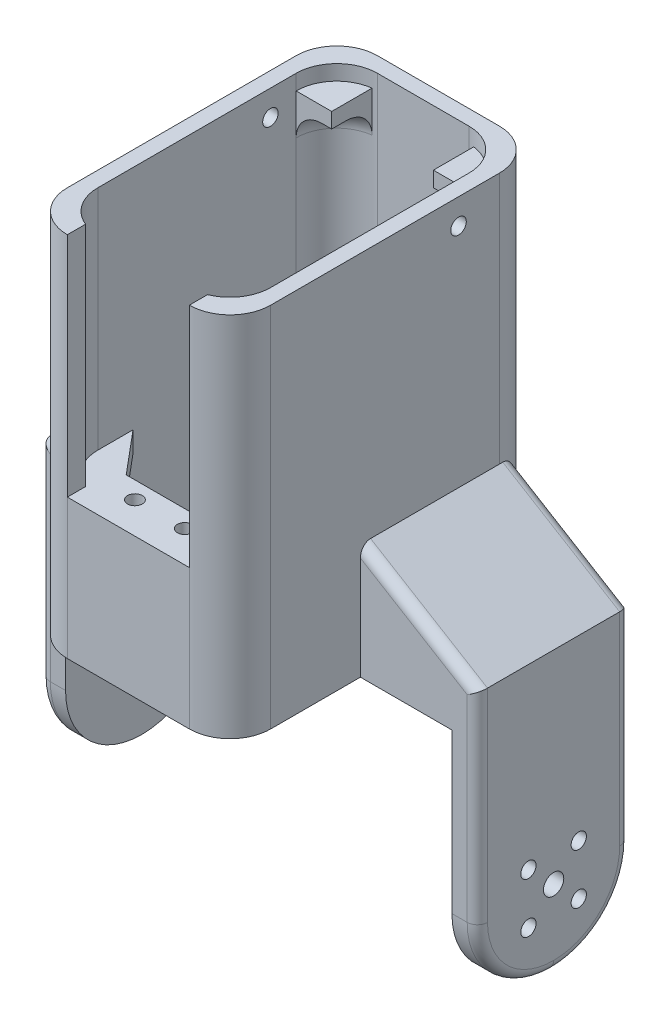
from build123d import *

# Parameters (mm, degrees)
SKETCH1_W           = 40
SKETCH1_H           = 61
SKETCH1_W_2         = 34
SKETCH1_H_2         = 55
BOSS_EXTRUDE1_DEPTH = 72.2
FILLET1_R           = 8
FILLET2_R           = 8
SKETCH2_R           = 1.45
BOSS_EXTRUDE2_DEPTH = 4
SKETCH3_W           = 24
SKETCH3_H           = 44.7
CUT_EXTRUDE1_DEPTH  = 4
BOSS_EXTRUDE3_DEPTH = 30
FILLET3_R           = 15
FILLET4_R           = 15
SKETCH6_R           = 2
CUT_EXTRUDE2_DEPTH  = 5
SKETCH8_R           = 1.505
CUT_EXTRUDE3_DEPTH  = 5
FILLET5_R           = 2
BOSS_EXTRUDE5_DEPTH = 3
FILLET7_R           = 5
SKETCH12_R          = 1.525
CUT_EXTRUDE4_DEPTH  = 3
CUT_EXTRUDE5_START  = -3
SKETCH13_R          = 1.525
CUT_EXTRUDE5_DEPTH  = 3
BOSS_EXTRUDE6_DEPTH = 4


with BuildPart() as part:
    # Sketch1 → Boss-Extrude1 (new body)
    with BuildSketch(Plane(origin=(0, 0, 0), x_dir=(1, 0, 0), z_dir=(0, 1, 0))):
        with Locations((20, 30.5)):
            Rectangle(SKETCH1_W, SKETCH1_H)
        with Locations((20, 30.5)):
            Rectangle(SKETCH1_W_2, SKETCH1_H_2, mode=Mode.SUBTRACT)
    extrude(amount=BOSS_EXTRUDE1_DEPTH)

    # Fillet1
    fillet1_edges = [part.edges().sort_by_distance(p)[0] for p in [
        (37, 36.1, -3),
        (37, 36.1, -58),
        (3, 36.1, -58),
        (3, 36.1, -3),
    ]]
    fillet(fillet1_edges, radius=FILLET1_R)

    # Fillet2
    fillet2_edges = [part.edges().sort_by_distance(p)[0] for p in [
        (0, 36.1, -61),
        (40, 36.1, -61),
        (40, 36.1, 0),
        (0, 36.1, 0),
    ]]
    fillet(fillet2_edges, radius=FILLET2_R)

    # Sketch2 → Boss-Extrude2 (add)
    # profile 1 of 2: a face of its own
    with BuildSketch(Plane(origin=(0, 27.5, 0), x_dir=(-1, 0, 0), z_dir=(0, -1, 0))):
        with BuildLine():
            ThreePointArc((-3.127033596, 51.42), (-5.869697865, 56.138403701), (-11, 58))
            Line((-11, 58), (-29, 58))
            ThreePointArc((-29, 58), (-34.130302135, 56.138403701), (-36.872966404, 51.42))
            Line((-36.872966404, 51.42), (-22.135286633, 51.42))
            Line((-22.135286633, 51.42), (-22.135286633, 57.223660853))
            Line((-22.135286633, 57.223660853), (-17.994848526, 57.223660853))
            Line((-17.994848526, 57.223660853), (-17.994848526, 51.42))
            Line((-17.994848526, 51.42), (-3.127033596, 51.42))
        make_face()
        with Locations(Location((-24.9, 54.8, 0), (0, 0, 90))):
            Circle(SKETCH2_R, mode=Mode.SUBTRACT)
        with Locations(Location((-15.1, 54.8, 0), (0, 0, 90))):
            Circle(SKETCH2_R, mode=Mode.SUBTRACT)
    # profile 2 of 2: a face of its own
    with BuildSketch(Plane(origin=(0, 27.5, 0), x_dir=(-1, 0, 0), z_dir=(0, -1, 0))):
        with BuildLine():
            ThreePointArc((-29, 3), (-34.130302135, 4.861596299), (-36.872966404, 9.58))
            Line((-36.872966404, 9.58), (-3.127033596, 9.58))
            ThreePointArc((-3.127033596, 9.58), (-5.869697865, 4.861596299), (-11, 3))
            Line((-11, 3), (-29, 3))
        make_face()
        with Locations(Location((-24.9, 6.2, 0), (0, 0, 90))):
            Circle(SKETCH2_R, mode=Mode.SUBTRACT)
        with Locations(Location((-15.1, 6.2, 0), (0, 0, 90))):
            Circle(SKETCH2_R, mode=Mode.SUBTRACT)
    extrude(amount=BOSS_EXTRUDE2_DEPTH)

    # Sketch3 → Cut-Extrude1 (cut)
    with BuildSketch(Plane.XY):
        with Locations((20, 49.85)):
            Rectangle(SKETCH3_W, SKETCH3_H)
    extrude(amount=-CUT_EXTRUDE1_DEPTH, mode=Mode.SUBTRACT)

    # Sketch5 → Boss-Extrude3 (add)
    with BuildSketch(Plane(origin=(0, 0, -55.65), x_dir=(-1, 0, 0), z_dir=(0, 0, -1))):
        Polygon((-40, 22.623135631), (-63, 8.644648184), (-63, -46.266055448), (-58, -46.266055448), (-58, 0), (-40, 0), align=None)
        Polygon((0, 22.623135631), (0, 0), (18, 0), (18, -46.266055448), (23, -46.266055448), (23, 8.644648184), align=None)
    extrude(amount=-BOSS_EXTRUDE3_DEPTH)

    # Fillet3
    fillet3_edges = [part.edges().sort_by_distance(p)[0] for p in [
        (60.5, -46.266055448, -55.65),
        (60.5, -46.266055448, -25.65),
    ]]
    fillet(fillet3_edges, radius=FILLET3_R - 0.0001)  # a hair under: the kernel refuses the full size

    # Fillet4
    fillet4_edges = [part.edges().sort_by_distance(p)[0] for p in [
        (-20.5, -46.266055448, -25.65),
        (-20.5, -46.266055448, -55.65),
    ]]
    fillet(fillet4_edges, radius=FILLET4_R - 0.0001)  # a hair under: the kernel refuses the full size

    # Sketch6 → Cut-Extrude2 (cut)
    with BuildSketch(Plane(origin=(63, 0, 0), x_dir=(0, 0, -1), z_dir=(1, 0, 0))):
        with Locations((40.65, -31.266055448)):
            Circle(SKETCH6_R)
    extrude(amount=-CUT_EXTRUDE2_DEPTH, mode=Mode.SUBTRACT)

    # Sketch8 → Cut-Extrude3 (cut)
    with BuildSketch(Plane(origin=(63, 0, -67), x_dir=(0, 0, 1), z_dir=(-1, 0, 0))):
        with Locations((31.299747468, -26.316307979)):
            Circle(SKETCH8_R)
        with Locations((21.400252532, -26.316307979)):
            Circle(SKETCH8_R)
        with Locations((21.400252532, -36.215802916)):
            Circle(SKETCH8_R)
        with Locations((31.299747468, -36.215802916)):
            Circle(SKETCH8_R)
    extrude(amount=CUT_EXTRUDE3_DEPTH, mode=Mode.SUBTRACT)

    # Fillet5
    fillet5_edges = [part.edges().sort_by_distance(p)[0] for p in [
        (63, -11.310753632, -25.65),
        (51.5, 15.633891908, -25.65),
        (51.5, 15.633891908, -55.65),
        (63, -11.310753632, -55.65),
        (-11.5, 15.633891908, -25.65),
        (-11.5, 15.633891908, -55.65),
        (63, -41.872686455, -30.043368993),
        (63, -41.872686455, -51.256631007),
        (-23, -11.310753632, -55.65),
        (-23, -11.310753632, -25.65),
        (-23, -41.872686455, -51.256631007),
        (-23, -41.872686455, -30.043368993),
    ]]
    fillet(fillet5_edges, radius=FILLET5_R)

    # Sketch11 → Boss-Extrude5 (add)
    with BuildSketch(Plane(origin=(0, 69.2, 0), x_dir=(1, 0, 0), z_dir=(0, 1, 0))):
        with BuildLine():
            ThreePointArc((10, 57.937253933), (5, 55.291502622), (3, 50))
            Line((3, 50), (10, 50))
            Line((10, 50), (10, 57.937253933))
        make_face()
        with BuildLine():
            Line((30, 50), (37, 50))
            ThreePointArc((37, 50), (35, 55.291502622), (30, 57.937253933))
            Line((30, 57.937253933), (30, 50))
        make_face()
    extrude(amount=-BOSS_EXTRUDE5_DEPTH)

    # Fillet7
    fillet7_edges = [part.edges().sort_by_distance(p)[0] for p in [
        (5, 66.2, -55.291502622),
        (35, 66.2, -55.291502622),
    ]]
    fillet(fillet7_edges, radius=FILLET7_R)

    # Sketch12 → Cut-Extrude4 (cut)
    with BuildSketch(Plane(origin=(3, 0, 0), x_dir=(0, 0, -1), z_dir=(1, 0, 0))):
        with Locations((44.95, 67.2)):
            Circle(SKETCH12_R)
    extrude(amount=-CUT_EXTRUDE4_DEPTH, mode=Mode.SUBTRACT)

    # Sketch13 → Cut-Extrude5 (cut)
    with BuildSketch(Plane.ZY.offset(-37).offset(CUT_EXTRUDE5_START)):
        with Locations(Location((-44.95, 67.2, 0), (0, 0, 180))):
            Circle(SKETCH13_R)
    extrude(amount=CUT_EXTRUDE5_DEPTH, mode=Mode.SUBTRACT)

    # Sketch14 → Boss-Extrude6 (add)
    with BuildSketch(Plane.XZ.offset(-23.5)):
        Polygon((3, -17.922275148), (10, -9.58), (3, -9.58), align=None)
        Polygon((37, -17.922275148), (30, -9.58), (37, -9.58), align=None)
    extrude(amount=-BOSS_EXTRUDE6_DEPTH)


solid = part.part
